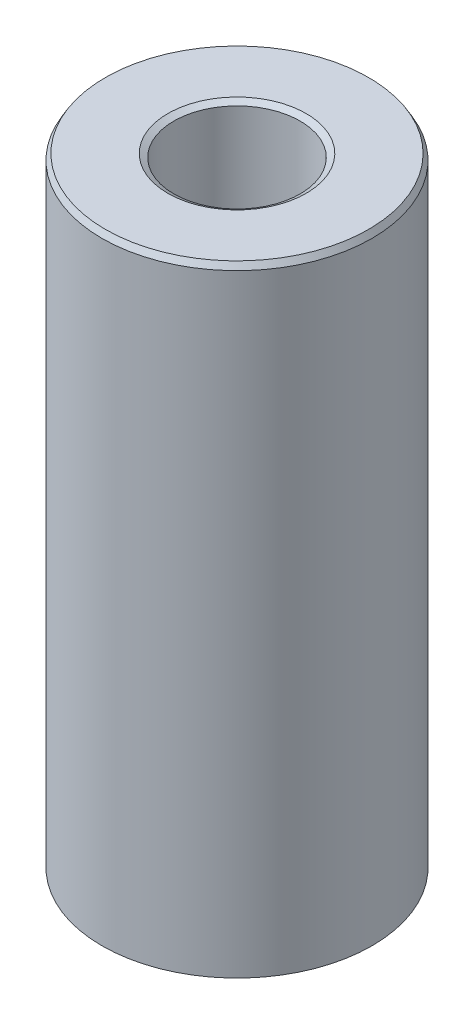
from build123d import *
from OCP.BRepFilletAPI import BRepFilletAPI_MakeChamfer

# Parameters (mm, degrees)
SKETCH1_R           = 50
BOSS_EXTRUDE1_DEPTH = 230.293208267
SKETCH2_R           = 23.38015468
CUT_EXTRUDE1_DEPTH  = 241.904466073
CHAMFER1_SIZE       = 2.225575192
CHAMFER1_SIZE2      = 1.284936436


with BuildPart() as part:
    # Sketch1 → Boss-Extrude1 (new body)
    with BuildSketch(Plane(origin=(0, 0, 0), x_dir=(1, 0, 0), z_dir=(0, 1, 0))):
        Circle(SKETCH1_R)
    extrude(amount=BOSS_EXTRUDE1_DEPTH)

    # Sketch2 → Cut-Extrude1 (cut, through all)
    with BuildSketch(Plane(origin=(0, 0, 0), x_dir=(1, 0, 0), z_dir=(0, 1, 0))):
        Circle(SKETCH2_R)
    extrude(amount=CUT_EXTRUDE1_DEPTH, mode=Mode.SUBTRACT)

    # Chamfer1: one chamfer whose edges measure the first distance from different faces: ONE call of the kernel's chamfer builder (chamfer() names one face for all edges)
    chamfer1_edges_1 = [part.edges().sort_by_distance(p)[0] for p in [
        (-23.38015468, 230.293208267, 0),
    ]]
    chamfer1_side_1 = [part.faces().sort_by_distance(p)[0] for p in [
        (-48.585786438, 230.293208267, 0),
    ]]
    chamfer1_edges_2 = [part.edges().sort_by_distance(p)[0] for p in [
        (-23.38015468, 0, 0),
    ]]
    chamfer1_side_2 = [part.faces().sort_by_distance(p)[0] for p in [
        (-23.38015468, 115.146604133, 0),
    ]]
    chamfer1_edges_3 = [part.edges().sort_by_distance(p)[0] for p in [
        (-50, 0, 0),
    ]]
    chamfer1_side_3 = [part.faces().sort_by_distance(p)[0] for p in [
        (-48.585786438, 0, 0),
    ]]
    chamfer1_edges_4 = [part.edges().sort_by_distance(p)[0] for p in [
        (-50, 230.293208267, 0),
    ]]
    chamfer1_side_4 = [part.faces().sort_by_distance(p)[0] for p in [
        (-50, 115.146604133, 0),
    ]]
    chamfer1 = BRepFilletAPI_MakeChamfer(part.part.solid().wrapped)
    for e in chamfer1_edges_1:
        chamfer1.Add(CHAMFER1_SIZE, CHAMFER1_SIZE2, e.wrapped, chamfer1_side_1[0].wrapped)  # the first distance lies on this face
    for e in chamfer1_edges_2:
        chamfer1.Add(CHAMFER1_SIZE, CHAMFER1_SIZE2, e.wrapped, chamfer1_side_2[0].wrapped)  # the first distance lies on this face
    for e in chamfer1_edges_3:
        chamfer1.Add(CHAMFER1_SIZE, CHAMFER1_SIZE2, e.wrapped, chamfer1_side_3[0].wrapped)  # the first distance lies on this face
    for e in chamfer1_edges_4:
        chamfer1.Add(CHAMFER1_SIZE, CHAMFER1_SIZE2, e.wrapped, chamfer1_side_4[0].wrapped)  # the first distance lies on this face
    add(Compound.cast(chamfer1.Shape()), mode=Mode.REPLACE)


solid = part.part
